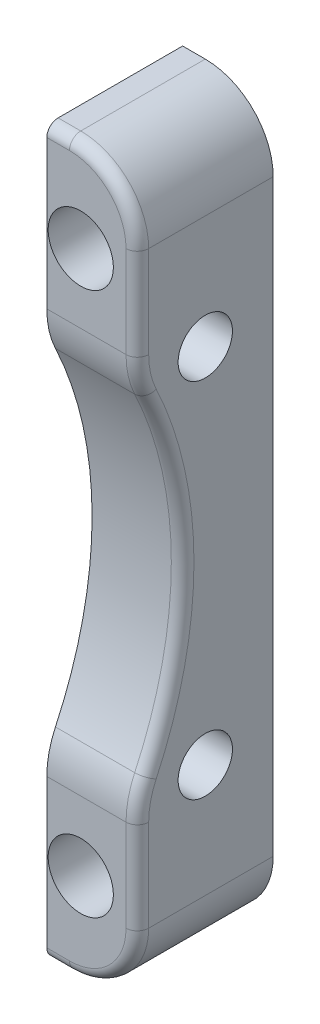
from build123d import *

# Parameters (mm, degrees)
BOSS_EXTRUDE1_DEPTH = 6.35
CUT_EXTRUDE1_REACH  = 29.861
SKETCH2_R           = 2.286
CUT_EXTRUDE2_REACH  = 29.861
SKETCH3_R           = 1.905
FILLET1_R           = 4.7625
FILLET2_R           = 6.35
FILLET3_R           = 0.79375


with BuildPart() as part:
    # Sketch1 → Boss-Extrude1 (new body)
    with BuildSketch(Plane(origin=(0, 0, 0), x_dir=(0, 0, -1), z_dir=(1, 0, 0))):
        with BuildLine():
            Line((0, -25.4), (0, 25.4))
            Line((0, 25.4), (-9.525, 25.4))
            Line((-9.525, 25.4), (-9.525, 12.7))
            ThreePointArc((-9.525, 12.7), (-6.35, 0), (-9.525, -12.7))
            Line((-9.525, -12.7), (-9.525, -25.4))
            Line((-9.525, -25.4), (0, -25.4))
        make_face()
    extrude(amount=BOSS_EXTRUDE1_DEPTH)

    # Sketch2 → Cut-Extrude1 (cut, up to next)
    with BuildSketch(Plane.XY.offset(9.525), mode=Mode.PRIVATE) as cut_extrude1_sk1:
        with Locations((2.38125, 19.05)):
            Circle(SKETCH2_R)
    cut_extrude1_tool1 = extrude(cut_extrude1_sk1.sketch, amount=-CUT_EXTRUDE1_REACH, mode=Mode.PRIVATE) & part.part
    # Sketch2 → Cut-Extrude1 (cut, up to next)
    with BuildSketch(Plane.XY.offset(9.525), mode=Mode.PRIVATE) as cut_extrude1_sk2:
        with Locations((2.38125, -19.05)):
            Circle(SKETCH2_R)
    cut_extrude1_tool2 = extrude(cut_extrude1_sk2.sketch, amount=-CUT_EXTRUDE1_REACH, mode=Mode.PRIVATE) & part.part
    add(cut_extrude1_tool1.solids().sort_by_distance((2.38125, 19.05, 9.525))[0], mode=Mode.SUBTRACT)
    add(cut_extrude1_tool2.solids().sort_by_distance((2.38125, -19.05, 9.525))[0], mode=Mode.SUBTRACT)

    # Sketch3 → Cut-Extrude2 (cut, up to next)
    with BuildSketch(Plane(origin=(6.35, 0, 0), x_dir=(0, 0, -1), z_dir=(1, 0, 0)), mode=Mode.PRIVATE) as cut_extrude2_sk1:
        with Locations((-4.7625, 12.7)):
            Circle(SKETCH3_R)
    cut_extrude2_tool1 = extrude(cut_extrude2_sk1.sketch, amount=-CUT_EXTRUDE2_REACH, mode=Mode.PRIVATE) & part.part
    # Sketch3 → Cut-Extrude2 (cut, up to next)
    with BuildSketch(Plane(origin=(6.35, 0, 0), x_dir=(0, 0, -1), z_dir=(1, 0, 0)), mode=Mode.PRIVATE) as cut_extrude2_sk2:
        with Locations((-4.7625, -12.7)):
            Circle(SKETCH3_R)
    cut_extrude2_tool2 = extrude(cut_extrude2_sk2.sketch, amount=-CUT_EXTRUDE2_REACH, mode=Mode.PRIVATE) & part.part
    add(cut_extrude2_tool1.solids().sort_by_distance((6.35, 12.7, 4.7625))[0], mode=Mode.SUBTRACT)
    add(cut_extrude2_tool2.solids().sort_by_distance((6.35, -12.7, 4.7625))[0], mode=Mode.SUBTRACT)

    # Fillet1
    fillet1_edges = [part.edges().sort_by_distance(p)[0] for p in [
        (6.35, -25.4, 4.7625),
        (6.35, 25.4, 4.7625),
    ]]
    fillet(fillet1_edges, radius=FILLET1_R)

    # Fillet2
    fillet2_edges = [part.edges().sort_by_distance(p)[0] for p in [
        (3.175, -12.7, 9.525),
        (3.175, 12.7, 9.525),
    ]]
    fillet(fillet2_edges, radius=FILLET2_R)

    # Fillet3
    fillet3_edges = [part.edges().sort_by_distance(p)[0] for p in [
        (0.79375, 25.4, 9.525),
        (4.955096045, 24.005096045, 9.525),
        (0.79375, -25.4, 9.525),
        (4.955096045, -24.005096045, 9.525),
        (6.35, -17.418265829, 9.525),
        (6.35, -12.813348054, 9.371965463),
        (6.35, 0, 6.35),
        (6.35, 12.813348054, 9.371965463),
        (6.35, 17.418265829, 9.525),
    ]]
    fillet(fillet3_edges, radius=FILLET3_R)


solid = part.part
